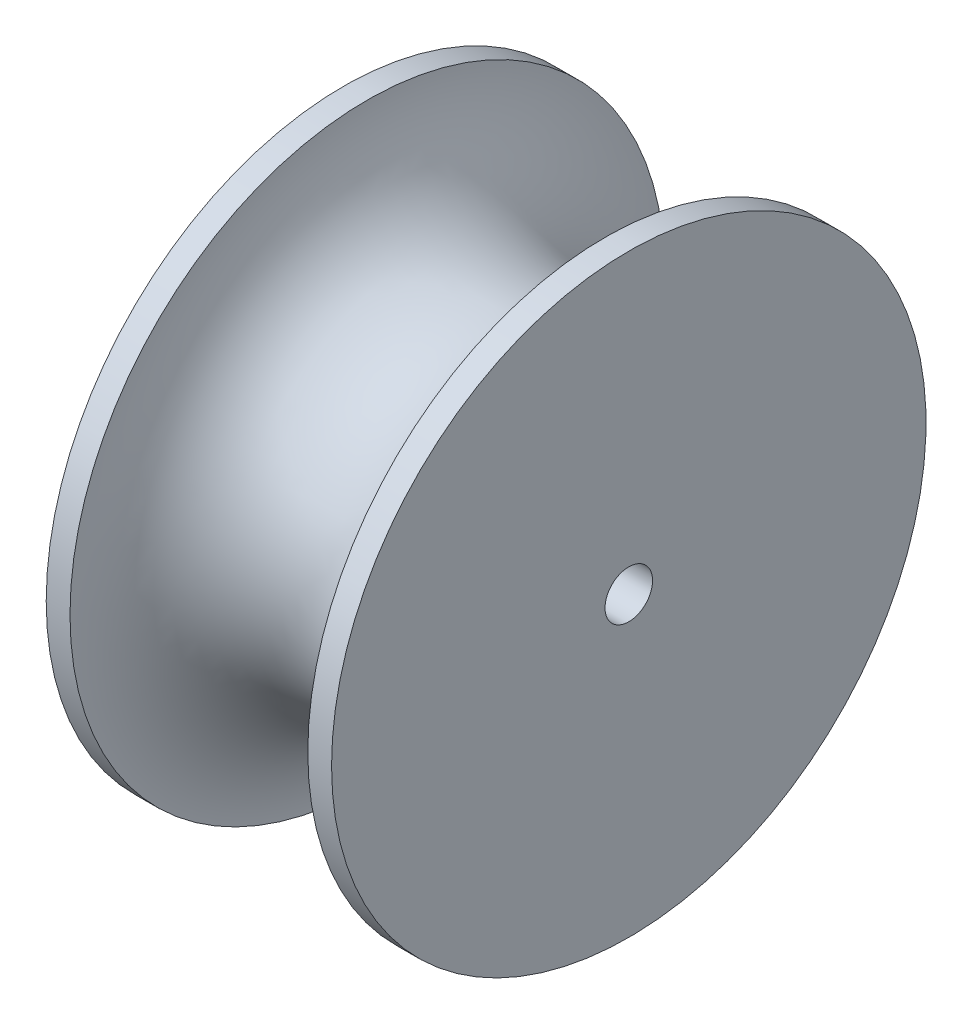
from build123d import *

# Parameters (mm, degrees)
SKETCH2_R          = 2
CUT_EXTRUDE1_DEPTH = 52.061237744


with BuildPart() as part:
    # Sketch1 → Revolve1 (revolve)
    with BuildSketch(Plane.XY):
        with BuildLine():
            Line((-10, -12.5), (10, -12.5))
            Line((10, -12.5), (12, -12.5))
            Line((12, -12.5), (12, 12.5))
            Line((12, 12.5), (10, 12.5))
            ThreePointArc((10, 12.5), (0, 2.5), (-10, 12.5))
            Line((-10, 12.5), (-12, 12.5))
            Line((-12, 12.5), (-12, -12.5))
            Line((-12, -12.5), (-10, -12.5))
        make_face()
    revolve(axis=Axis((-10, -12.5, 0), (1, 0, 0)))

    # Sketch2 → Cut-Extrude1 (cut, through all)
    with BuildSketch(Plane(origin=(12, 0, 0), x_dir=(0, 0, -1), z_dir=(1, 0, 0))):
        with Locations((0, -12.5)):
            Circle(SKETCH2_R)
    extrude(amount=-CUT_EXTRUDE1_DEPTH, mode=Mode.SUBTRACT)


solid = part.part
